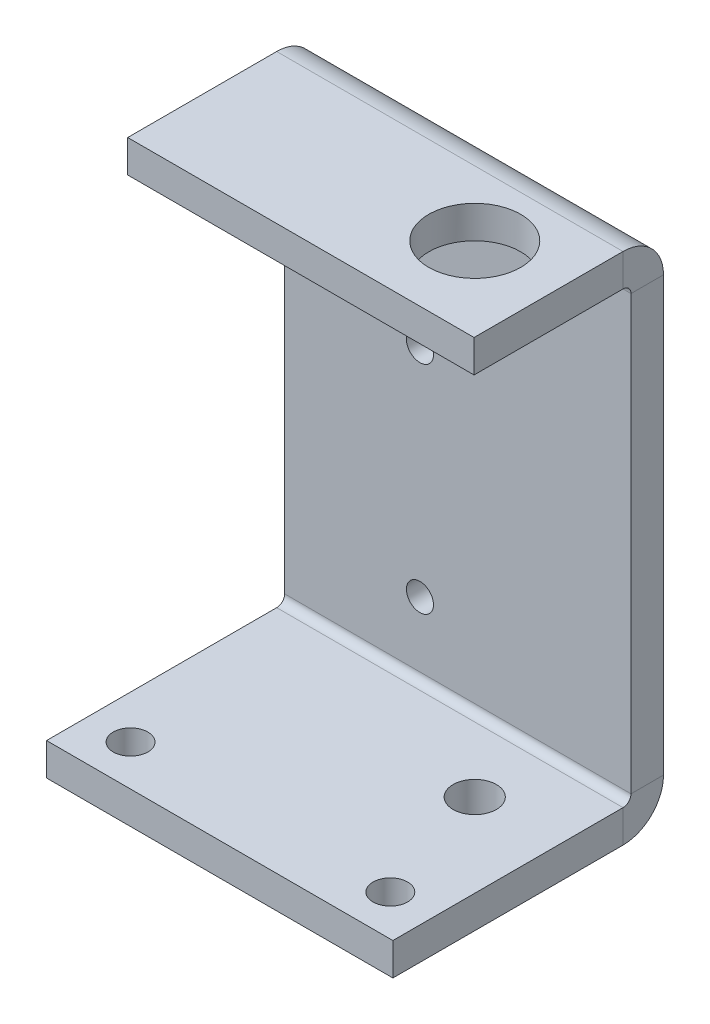
from build123d import *

# Parameters (mm, degrees)
SKETCH1_W                        = 32
SKETCH1_H                        = 25
BASE_FLANGE1_DEPTH               = 3
EDGE_FLANGE1_STRIP_W             = 13.4732
EDGE_FLANGE1_STRIP_H             = 3
EDGE_FLANGE1_STRIP_CUT_DEPTH     = 32
EDGE_FLANGE1_DEPTH               = 32
EDGE_FLANGE2_STRIP_W             = 13.4732
EDGE_FLANGE2_STRIP_H             = 3
EDGE_FLANGE2_STRIP_CUT_DEPTH     = 32
EDGE_FLANGE2_DEPTH               = 32
TAP_DRILL_FOR_M3X0_5_TAP1_D      = 2.5
TAP_DRILL_FOR_M10X1_5_TAP2_D     = 8.5
TAP_DRILL_FOR_M10X1_5_TAP2_DEPTH = 3
M3_CLEARANCE_HOLE1_D             = 3.2
F_4_0_4_DIAMETER_HOLE1_D         = 4


# Sheet-metal steps are written as plain solids
with BuildPart() as part:
    # Sketch1 → Base-Flange1 (new body)
    with BuildSketch(Plane(origin=(0, 0, 0), x_dir=(1, 0, 0), z_dir=(0, 1, 0))):
        Rectangle(SKETCH1_W, SKETCH1_H)
    extrude(amount=-BASE_FLANGE1_DEPTH)

    # Edge-Flange1 strip (across the edge) → Edge-Flange1 strip cut (cut)
    with BuildSketch(Plane(origin=(16, 0, -12.5), x_dir=(0, 0, 1), z_dir=(-1, 0, 0))):
        with Locations((-3, -1.5)):
            Rectangle(EDGE_FLANGE1_STRIP_W, EDGE_FLANGE1_STRIP_H)
    extrude(amount=EDGE_FLANGE1_STRIP_CUT_DEPTH, mode=Mode.SUBTRACT)

    # Edge-Flange1 section (across the edge) → Edge-Flange1 (add)
    with BuildSketch(Plane(origin=(16, 0, -12.5), x_dir=(0, 0, 1), z_dir=(-1, 0, 0))):
        with BuildLine():
            Line((0, 0.7366), (0, 44.5))
            Line((0, 44.5), (3, 44.5))
            Line((3, 44.5), (3, 0.7366))
            ThreePointArc((3, 0.7366), (3.215745145, 0.215745145), (3.7366, 0))
            Line((3.7366, 0), (3.7366, -3))
            ThreePointArc((3.7366, -3), (1.094424801, -1.905575199), (0, 0.7366))
        make_face()
    extrude(amount=EDGE_FLANGE1_DEPTH)

    # Edge-Flange2 strip (across the edge) → Edge-Flange2 strip cut (cut)
    with BuildSketch(Plane(origin=(16, 44.5, -9.5), x_dir=(0, -1, 0), z_dir=(-1, 0, 0))):
        with Locations((-3, -1.5)):
            Rectangle(EDGE_FLANGE2_STRIP_W, EDGE_FLANGE2_STRIP_H)
    extrude(amount=EDGE_FLANGE2_STRIP_CUT_DEPTH, mode=Mode.SUBTRACT)

    # Edge-Flange2 section (across the edge) → Edge-Flange2 (add)
    with BuildSketch(Plane(origin=(16, 44.5, -9.5), x_dir=(0, -1, 0), z_dir=(-1, 0, 0))):
        with BuildLine():
            Line((0, 0.7366), (0, 14.5))
            Line((0, 14.5), (3, 14.5))
            Line((3, 14.5), (3, 0.7366))
            ThreePointArc((3, 0.7366), (3.215745145, 0.215745145), (3.7366, 0))
            Line((3.7366, 0), (3.7366, -3))
            ThreePointArc((3.7366, -3), (1.094424801, -1.905575199), (0, 0.7366))
        make_face()
    extrude(amount=EDGE_FLANGE2_DEPTH)

    # Tap Drill for M3x0.5 Tap1 (through all)
    with Locations(Plane.XY.offset(-9.5)):
        with Locations((-3.5, 6.7366), (-3.5, 26.7366)):
            Hole(TAP_DRILL_FOR_M3X0_5_TAP1_D / 2)

    # Tap Drill for M10x1.5 Tap2
    with Locations(Plane(origin=(0, 44.5, 0), x_dir=(1, 0, 0), z_dir=(0, 1, 0))):
        with Locations((8.3, 2.7634)):
            Hole(TAP_DRILL_FOR_M10X1_5_TAP2_D / 2, depth=TAP_DRILL_FOR_M10X1_5_TAP2_DEPTH)

    # M3 Clearance Hole1 (through all)
    with Locations(Plane(origin=(0, 0, 0), x_dir=(1, 0, 0), z_dir=(0, 1, 0))):
        with Locations((-12, -8.7366), (12, -8.7366)):
            Hole(M3_CLEARANCE_HOLE1_D / 2)

    # Ø4.0 (4) Diameter Hole1 (through all)
    with Locations(Plane(origin=(0, 0, 0), x_dir=(1, 0, 0), z_dir=(0, 1, 0))):
        with Locations((8.3, 2.7634)):
            Hole(F_4_0_4_DIAMETER_HOLE1_D / 2)


solid = part.part
